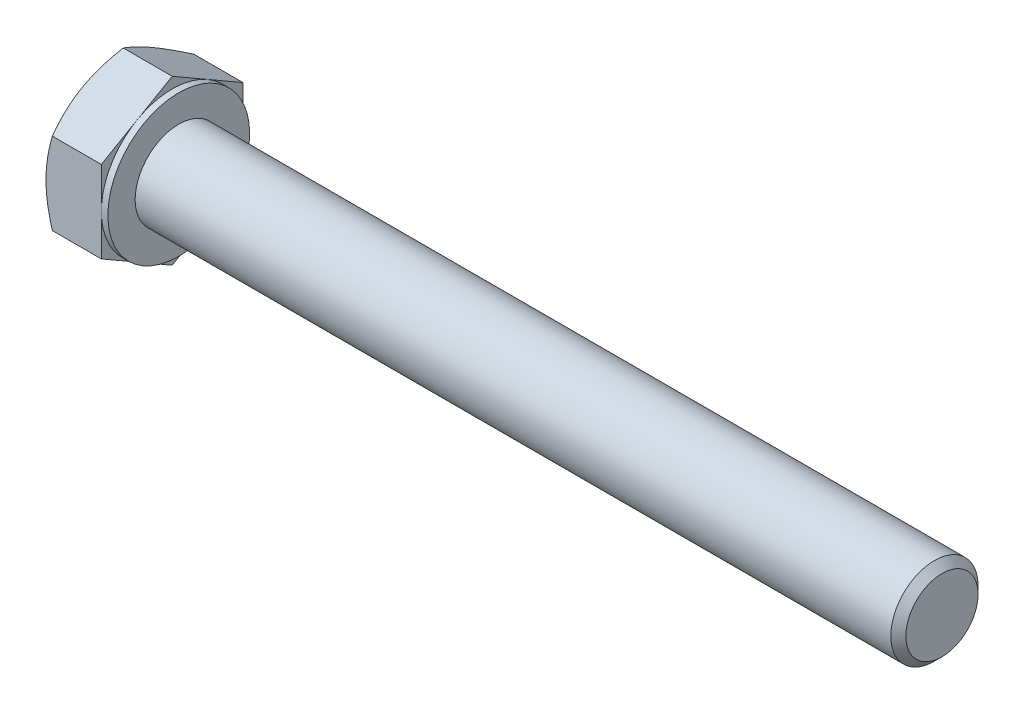
from build123d import *

# Parameters (mm, degrees)
BASEHEAD_DEPTH = 5.675
SKETCH4_W      = 0.6
SKETCH4_H      = 11.005553499


# Read off the part's stored shape, not the designer's step: HeadChamfer
with BuildPart() as part:
    # Sketch1 → BaseHead (new body)
    with BuildSketch(Plane(origin=(0, 0, 0), x_dir=(0, 0, -1), z_dir=(1, 0, 0))):
        Polygon((6.5, 3.75277675), (6.5, -3.75277675), (0, -7.505553499), (-6.5, -3.75277675), (-6.5, 3.75277675), (0, 7.505553499), align=None)
    extrude(amount=BASEHEAD_DEPTH)

    # HeadChamfer outline → HeadChamfer (revolve, cut)
    with BuildSketch(Plane.YX):
        Polygon((7.505553503, 0.580556586), (6.499999425, -3.32e-07), (7.505553503, -1.347e-06), align=None)
    revolve(axis=Axis((0, 0, 0), (1, 0, 0)), mode=Mode.SUBTRACT)

    # HeadChamfer 2 outline → HeadChamfer 2 (revolve)
    with BuildSketch(Plane.YX):
        Polygon((4, 5.675), (4, 74.9845), (3.3095, 75.675), (0, 75.675), (0, 5.675), align=None)
    revolve(axis=Axis((0, 0, 0), (1, 0, 0)))

    # Sketch4 → BearingFace (revolve, cut)
    with BuildSketch(Plane.XY, mode=Mode.PRIVATE) as bearingface_sk:
        with Locations((5.375, 12.00277675)):
            Rectangle(SKETCH4_W, SKETCH4_H)
    revolve(bearingface_sk.sketch.rotate(Axis((0, 0, 0), (1, 0, 0)), 90), axis=Axis((0, 0, 0), (1, 0, 0)), mode=Mode.SUBTRACT)


solid = part.part
